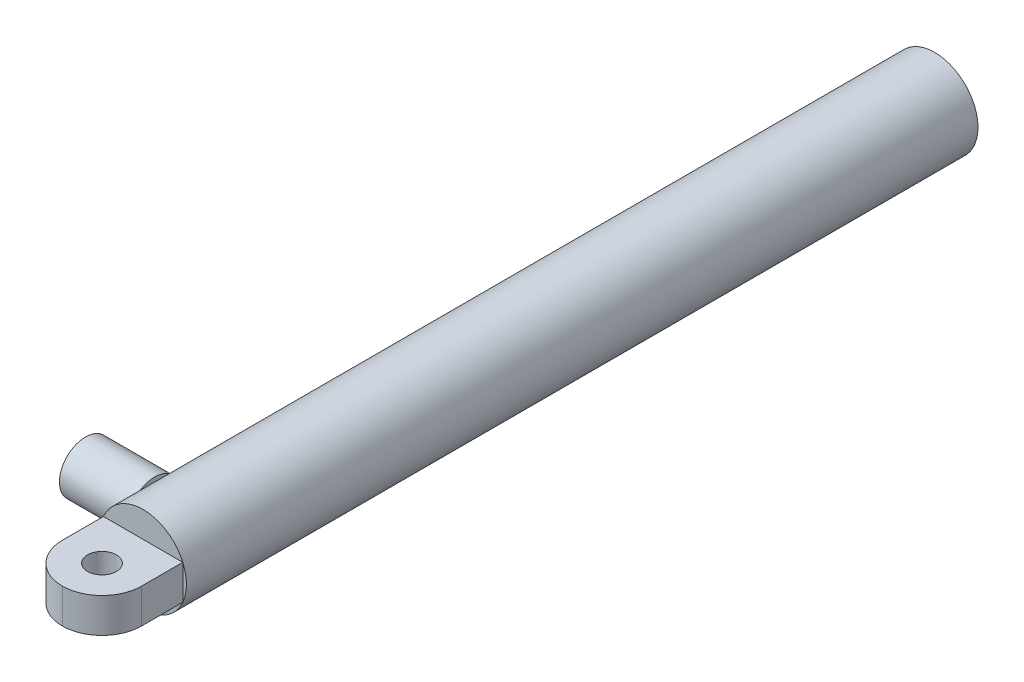
from build123d import *

# Parameters (mm, degrees)
SKETCH1_R           = 37.5
SKETCH1_R_2         = 17.5
BOSS_EXTRUDE1_DEPTH = 664
SKETCH5_R           = 37.5
BOSS_EXTRUDE2_DEPTH = 22
SKETCH8_W           = 68.738635424
SKETCH8_H           = 15
BOSS_EXTRUDE3_DEPTH = 70
FILLET1_R           = 34.36
SKETCH9_R           = 12.5
CUT_EXTRUDE1_DEPTH  = 100
SKETCH10_R          = 22.5
BOSS_EXTRUDE4_DEPTH = 60


with BuildPart() as part:
    # Sketch1 → Boss-Extrude1 (new body)
    with BuildSketch(Plane.XY):
        Circle(SKETCH1_R)
        Circle(SKETCH1_R_2, mode=Mode.SUBTRACT)
    extrude(amount=BOSS_EXTRUDE1_DEPTH)

    # Sketch5 → Boss-Extrude2 (add)
    with BuildSketch(Plane.XY.offset(664)):
        Circle(SKETCH5_R)
    extrude(amount=BOSS_EXTRUDE2_DEPTH)

    # Sketch8 → Boss-Extrude3 (add)
    with BuildSketch(Plane.XY.offset(686)):
        with Locations((0, -7.5)):
            Rectangle(SKETCH8_W, SKETCH8_H)
    boss_extrude3 = extrude(amount=BOSS_EXTRUDE3_DEPTH)

    # Mirror1: Boss-Extrude3 across plane
    add(boss_extrude3.mirror(Plane(origin=(-34.369317712, 0, 756), x_dir=(0, 0, 1), z_dir=(0, -1, 0))))

    # Fillet1
    fillet1_edges = [part.edges().sort_by_distance(p)[0] for p in [
        (34.369317712, 0, 756),
        (-34.369317712, 0, 756),
    ]]
    fillet(fillet1_edges, radius=FILLET1_R)

    # Sketch9 → Cut-Extrude1 (cut, symmetric)
    with BuildSketch(Plane(origin=(0, 15, 0), x_dir=(1, 0, 0), z_dir=(0, 1, 0))):
        with Locations((0, -721.64)):
            Circle(SKETCH9_R)
    extrude(amount=CUT_EXTRUDE1_DEPTH, both=True, mode=Mode.SUBTRACT)

    # Sketch10 → Boss-Extrude4 (add)
    with BuildSketch(Plane.ZY.offset(34.369317712)):
        with Locations((641.64, 0)):
            Circle(SKETCH10_R)
    extrude(amount=BOSS_EXTRUDE4_DEPTH)


solid = part.part
